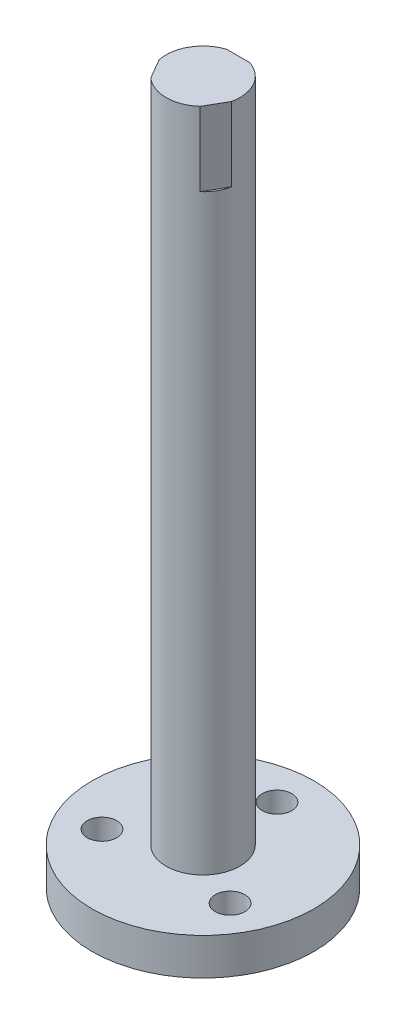
from build123d import *

# Parameters (mm, degrees)
SKETCH1_R             = 15
BOSS_EXTRUDE1_DEPTH   = 5
SKETCH2_R             = 5
BOSS_EXTRUDE2_DEPTH   = 90
F_4_0MM_DOWEL_HOLE1_D = 4
CUT_EXTRUDE2_START    = -10
CUT_EXTRUDE2_DEPTH    = 10
CIRPATTERN1_COUNT     = 3


with BuildPart() as part:
    # Sketch1 → Boss-Extrude1 (new body)
    with BuildSketch(Plane(origin=(0, 0, 0), x_dir=(1, 0, 0), z_dir=(0, 1, 0))):
        Circle(SKETCH1_R)
    extrude(amount=-BOSS_EXTRUDE1_DEPTH)

    # Sketch2 → Boss-Extrude2 (add)
    with BuildSketch(Plane(origin=(0, 0, 0), x_dir=(1, 0, 0), z_dir=(0, 1, 0))):
        Circle(SKETCH2_R)
    extrude(amount=BOSS_EXTRUDE2_DEPTH)

    # Ø4.0mm Dowel Hole1 (through all)
    with Locations(Plane(origin=(0, 0, 0), x_dir=(1, 0, 0), z_dir=(0, 1, 0))):
        with Locations((8.660254038, -5), (-8.660254038, -5), (0, 10)):
            Hole(F_4_0MM_DOWEL_HOLE1_D / 2)

    # Sketch7 → Cut-Extrude2 (cut)
    with BuildSketch(Plane(origin=(0, 90, 0), x_dir=(1, 0, 0), z_dir=(0, 1, 0)).offset(CUT_EXTRUDE2_START)):
        with BuildLine():
            Line((-1.5612495, 4.75), (1.5612495, 4.75))
            ThreePointArc((1.5612495, 4.75), (0, 5), (-1.5612495, 4.75))
        make_face()
    cut_extrude2 = extrude(amount=CUT_EXTRUDE2_DEPTH, mode=Mode.SUBTRACT)

    # CirPattern1: Cut-Extrude2 ×3 about axis
    cirpattern1_axis = Axis((0, 90, 0), (0, 1, 0))
    for i in range(1, CIRPATTERN1_COUNT):
        add(cut_extrude2.rotate(cirpattern1_axis, i * 360 / CIRPATTERN1_COUNT), mode=Mode.SUBTRACT)


solid = part.part
